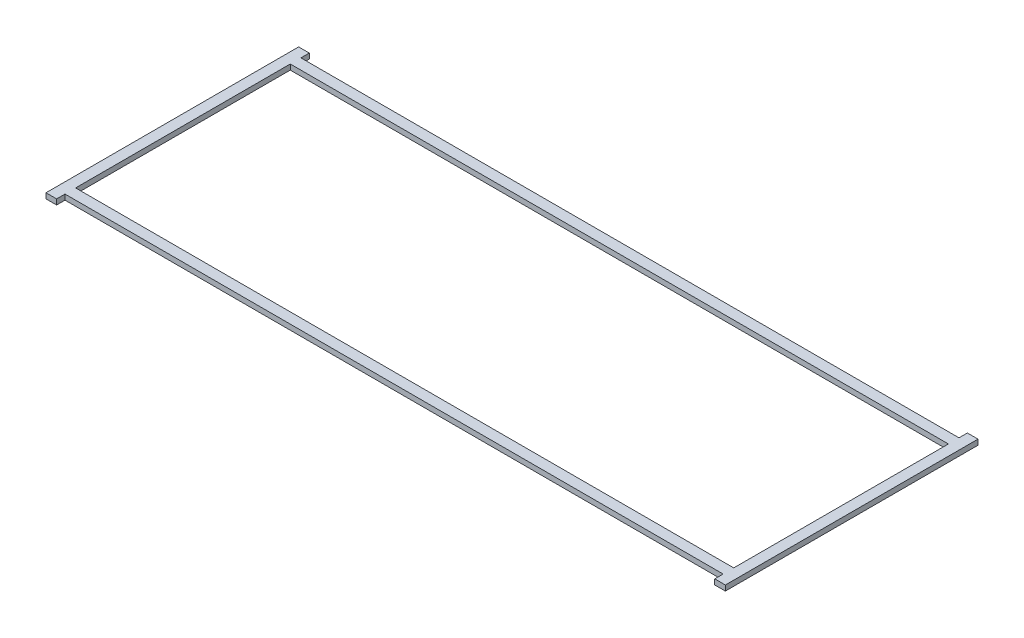
from build123d import *

# Parameters (mm, degrees)
SKETCH1_W           = 393.7
SKETCH1_H           = 128.4097
BOSS_EXTRUDE1_DEPTH = 3.175


with BuildPart() as part:
    # Sketch1 → Boss-Extrude1 (new body)
    with BuildSketch(Plane(origin=(0, 0, 0), x_dir=(1, 0, 0), z_dir=(0, 1, 0))):
        Polygon((196.85, 75.565), (203.2, 75.565), (203.2, -75.565), (196.85, -75.565), (196.85, -70.55485), (-196.85, -70.55485), (-196.85, -75.565), (-203.2, -75.565), (-203.2, 75.565), (-196.85, 75.565), (-196.85, 70.55485), (196.85, 70.55485), align=None)
        Rectangle(SKETCH1_W, SKETCH1_H, mode=Mode.SUBTRACT)
    extrude(amount=BOSS_EXTRUDE1_DEPTH)


solid = part.part
